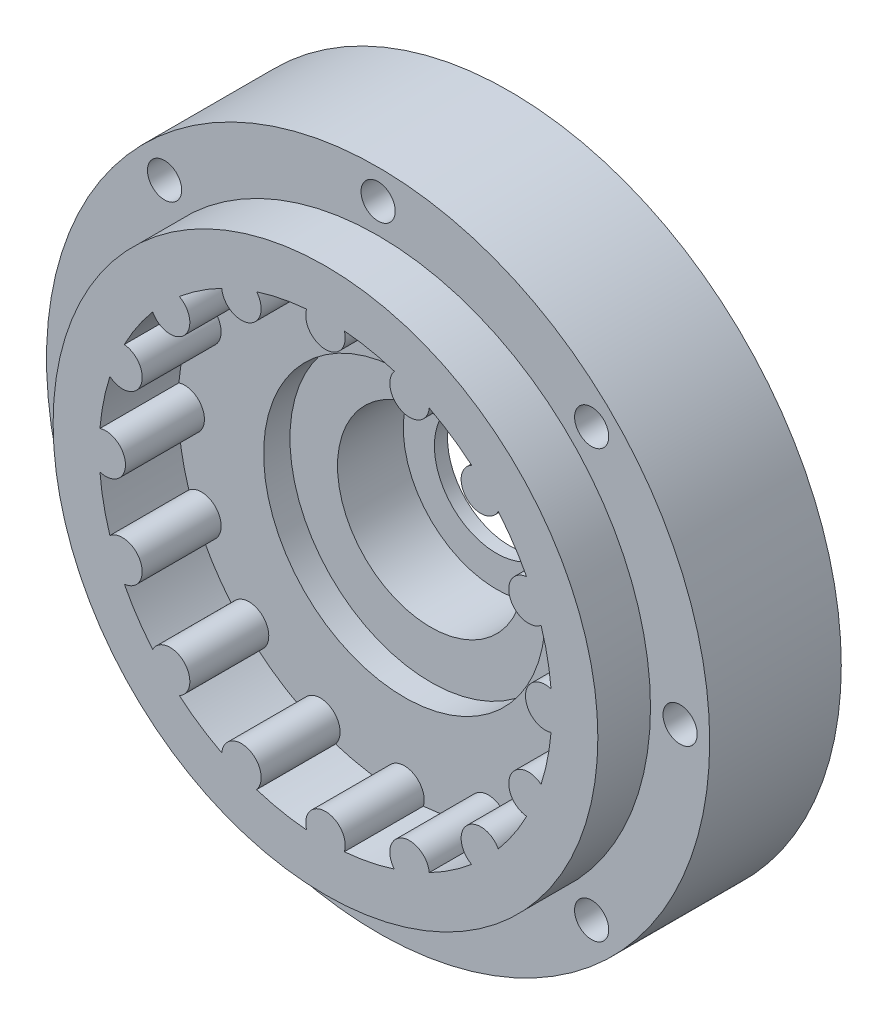
from build123d import *

# Parameters (mm, degrees)
SKETCH1_R             = 32.004
BOSS_EXTRUDE1_DEPTH   = 12.7
SKETCH2_OUTSIDE_W     = 84.29
SKETCH2_OUTSIDE_H     = 84.29
SKETCH2_OUTSIDE_R     = 32.004
SKETCH2_OUTSIDE_R_2   = 26.289
CUT_EXTRUDE1_DEPTH    = 2.54
SKETCH4_R             = 13.589
CUT_EXTRUDE3_DEPTH    = 2.54
SKETCH5_R             = 6
CUT_EXTRUDE4_DEPTH    = 46.897455616
M4X0_7_TAPPED_HOLE1_D = 3.3
SKETCH5_3_R           = 9
SKETCH5_3_R_2         = 6
CUT_EXTRUDE5_DEPTH    = 6.35
BOSS_EXTRUDE2_START   = 7.62
SKETCH8_R             = 26.289
SKETCH8_R_2           = 21.844
BOSS_EXTRUDE2_DEPTH   = 7.62
SKETCH3_R             = 1.905
BOSS_EXTRUDE3_DEPTH   = 7.62


with BuildPart() as part:
    # Sketch1 → Boss-Extrude1 (new body)
    with BuildSketch(Plane.XY):
        Circle(SKETCH1_R)
    extrude(amount=BOSS_EXTRUDE1_DEPTH)

    # Sketch2 outside → Cut-Extrude1 (cut)
    # profile 1 of 2: a face of its own
    with BuildSketch(Plane.XY.offset(12.7)):
        Rectangle(SKETCH2_OUTSIDE_W, SKETCH2_OUTSIDE_H)
        Circle(SKETCH2_OUTSIDE_R, mode=Mode.SUBTRACT)
    # profile 2 of 2: a face of its own
    with BuildSketch(Plane.XY.offset(12.7)):
        Circle(SKETCH2_OUTSIDE_R_2)
    extrude(amount=-CUT_EXTRUDE1_DEPTH, mode=Mode.SUBTRACT)

    # Sketch4 → Cut-Extrude3 (cut)
    with BuildSketch(Plane.XY.offset(10.16)):
        Circle(SKETCH4_R)
    extrude(amount=-CUT_EXTRUDE3_DEPTH, mode=Mode.SUBTRACT)

    # Sketch5 → Cut-Extrude4 (cut, through all)
    with BuildSketch(Plane.XY.offset(7.62)):
        Circle(SKETCH5_R)
    extrude(amount=-CUT_EXTRUDE4_DEPTH, mode=Mode.SUBTRACT)

    # M4x0.7 Tapped Hole1 (through all)
    with Locations(Plane.XY.offset(12.7)):
        with Locations((-20.609687798, 20.609687798), (0, 29.1465), (20.609687798, 20.609687798), (29.1465, 0), (20.609687798, -20.609687798), (0, -29.1465), (-20.609687798, -20.609687798), (-29.1465, 0)):
            Hole(M4X0_7_TAPPED_HOLE1_D / 2)

    # Sketch5<3> → Cut-Extrude5 (cut)
    with BuildSketch(Plane.XY.offset(7.62)):
        Circle(SKETCH5_3_R)
        Circle(SKETCH5_3_R_2, mode=Mode.SUBTRACT)
    extrude(amount=-CUT_EXTRUDE5_DEPTH, mode=Mode.SUBTRACT)

    # Sketch8 → Boss-Extrude2 (add)
    with BuildSketch(Plane.XY.offset(10.16).offset(BOSS_EXTRUDE2_START)):
        Circle(SKETCH8_R)
        Circle(SKETCH8_R_2, mode=Mode.SUBTRACT)
    extrude(amount=-BOSS_EXTRUDE2_DEPTH)

    # Sketch3 → Boss-Extrude3 (add)
    with BuildSketch(Plane.XY.offset(10.16)):
        with Locations((0, 21.209)):
            Circle(SKETCH3_R)
        with Locations((8.116332917, 19.594561005)):
            Circle(SKETCH3_R)
        with Locations((14.997027722, 14.997027722)):
            Circle(SKETCH3_R)
        with Locations((19.594561005, 8.116332917)):
            Circle(SKETCH3_R)
        with Locations((21.209, 0)):
            Circle(SKETCH3_R)
        with Locations((19.594561005, -8.116332917)):
            Circle(SKETCH3_R)
        with Locations((14.997027722, -14.997027722)):
            Circle(SKETCH3_R)
        with Locations((8.116332917, -19.594561005)):
            Circle(SKETCH3_R)
        with Locations((0, -21.209)):
            Circle(SKETCH3_R)
        with Locations((-8.116332917, -19.594561005)):
            Circle(SKETCH3_R)
        with Locations((-14.997027722, -14.997027722)):
            Circle(SKETCH3_R)
        with Locations((-19.594561005, -8.116332917)):
            Circle(SKETCH3_R)
        with Locations((-21.209, 0)):
            Circle(SKETCH3_R)
        with Locations((-19.594561005, 8.116332917)):
            Circle(SKETCH3_R)
        with Locations((-14.997027722, 14.997027722)):
            Circle(SKETCH3_R)
        with Locations((-8.116332917, 19.594561005)):
            Circle(SKETCH3_R)
    extrude(amount=BOSS_EXTRUDE3_DEPTH)


solid = part.part
